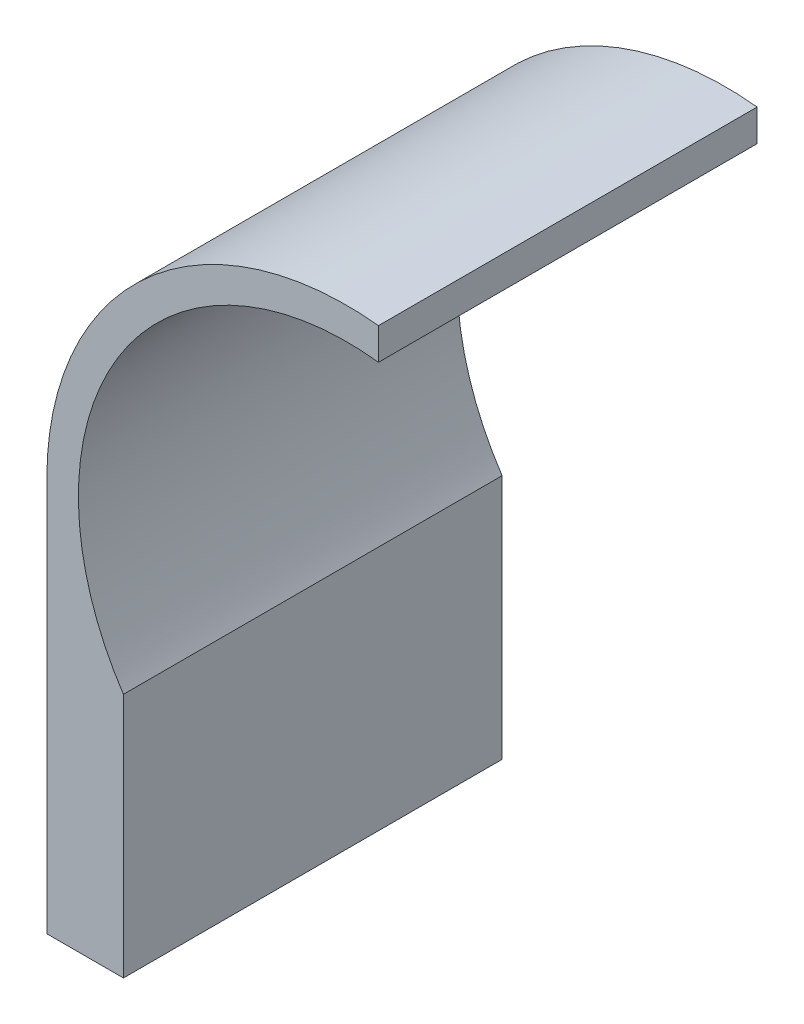
from build123d import *

# Parameters (mm, degrees)
INNER_RING_LEFT_SIDE_DEPTH = 120


with BuildPart() as part:
    # Sketch1 → Inner Ring - Left Side (new body)
    with BuildSketch(Plane.XY):
        with BuildLine():
            Line((-70.731226598, -47.139087644), (-70.731226598, -63.419977798))
            Line((-70.731226598, -63.419977798), (-70.731226598, -125))
            Line((-70.731226598, -125), (-95, -125))
            Line((-95, -125), (-95, 0))
            ThreePointArc((-95, 0), (-63.503936886, 70.655856091), (10.1, 94.461579491))
            Line((10.1, 94.461579491), (10.1, 84.397808028))
            ThreePointArc((10.1, 84.397808028), (-72.419093756, 44.50252644), (-70.731226598, -47.139087644))
        make_face()
    extrude(amount=INNER_RING_LEFT_SIDE_DEPTH)


solid = part.part
